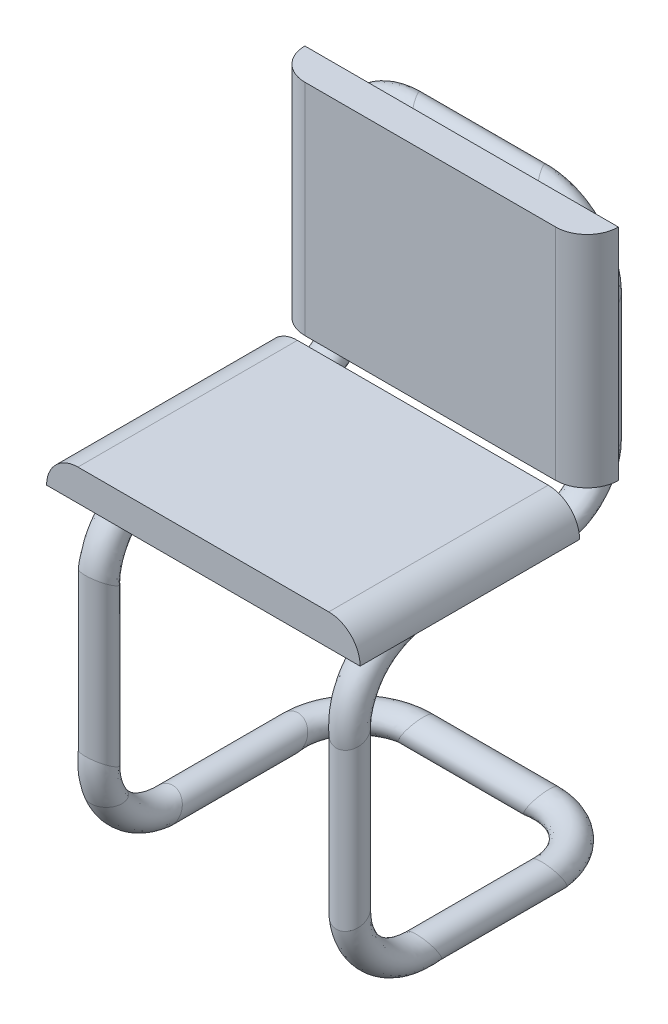
from build123d import *

# Parameters (mm, degrees)
SKETCH_1_R      = 5
SKETCH_3_W      = 100
SKETCH_3_H      = 70
EXTRUDE_1_DEPTH = 10
SKETCH_4_W      = 100
SKETCH_4_H      = 70
EXTRUDE_2_DEPTH = 10
FILLET_1_R      = 10


with BuildPart() as part:
    # 扫描1: sweep along a curve in space
    with BuildLine() as sweep_1_path:
        Line((-40, 20, 80), (-40, 70, 80))
        ThreePointArc((-40, 70, 80), (-40, 84.142135624, 74.142135624), (-40, 90, 60))
        Line((-40, 90, 60), (-40, 90, 20))
        ThreePointArc((-40, 90, 20), (-40, 95.857864376, 5.857864376), (-40, 110, 0))
        Line((-40, 110, 0), (-40, 150, 0))
        ThreePointArc((-40, 150, 0), (-34.142135624, 164.142135624, 0), (-20, 170, 0))
        Line((-20, 170, 0), (20, 170, 0))
        ThreePointArc((20, 170, 0), (34.142135624, 164.142135624, 0), (40, 150, 0))
        Line((40, 150, 0), (40, 110, 0))
        ThreePointArc((40, 110, 0), (40, 95.857864376, 5.857864376), (40, 90, 20))
        Line((40, 90, 20), (40, 90, 60))
        ThreePointArc((40, 90, 60), (40, 84.142135624, 74.142135624), (40, 70, 80))
        Line((40, 70, 80), (40, 20, 80))
        ThreePointArc((40, 20, 80), (40, 5.857864376, 74.142135624), (40, 0, 60))
        Line((40, 0, 60), (40, 0, 20))
        ThreePointArc((40, 0, 20), (34.142135624, 0, 5.857864376), (20, 0, 0))
        Line((20, 0, 0), (-20, 0, 0))
        ThreePointArc((-20, 0, 0), (-34.142135624, 0, 5.857864376), (-40, 0, 20))
        Line((-40, 0, 60), (-40, 0, 20))
        ThreePointArc((-40, 20, 80), (-40, 5.857864376, 74.142135624), (-40, 0, 60))
    # 草图1 → 扫描1 (sweep)
    with BuildSketch(Plane(origin=(0, 10, 0), x_dir=(1, 0, 0), z_dir=(0, 1, 0))):
        with Locations((-40, -80)):
            Circle(SKETCH_1_R)
    sweep(path=sweep_1_path.line)

    # 草图3 → 凸台-拉伸1 (add)
    with BuildSketch(Plane(origin=(0, 95, 0), x_dir=(1, 0, 0), z_dir=(0, 1, 0))):
        with Locations((0, -54.055168015)):
            Rectangle(SKETCH_3_W, SKETCH_3_H)
    extrude(amount=EXTRUDE_1_DEPTH)

    # 草图4 → 凸台-拉伸2 (add)
    with BuildSketch(Plane.XY.offset(6.67)):
        with Locations((0, 140.110077228)):
            Rectangle(SKETCH_4_W, SKETCH_4_H)
    extrude(amount=EXTRUDE_2_DEPTH)

    # 圆角1
    fillet_1_edges = [part.edges().sort_by_distance(p)[0] for p in [
        (-50, 105, 54.055168015),
        (50, 105, 54.055168015),
        (50, 140.110077228, 16.67),
        (-50, 140.110077228, 16.67),
    ]]
    fillet(fillet_1_edges, radius=FILLET_1_R - 0.0001)  # a hair under: the kernel refuses the full size


solid = part.part
